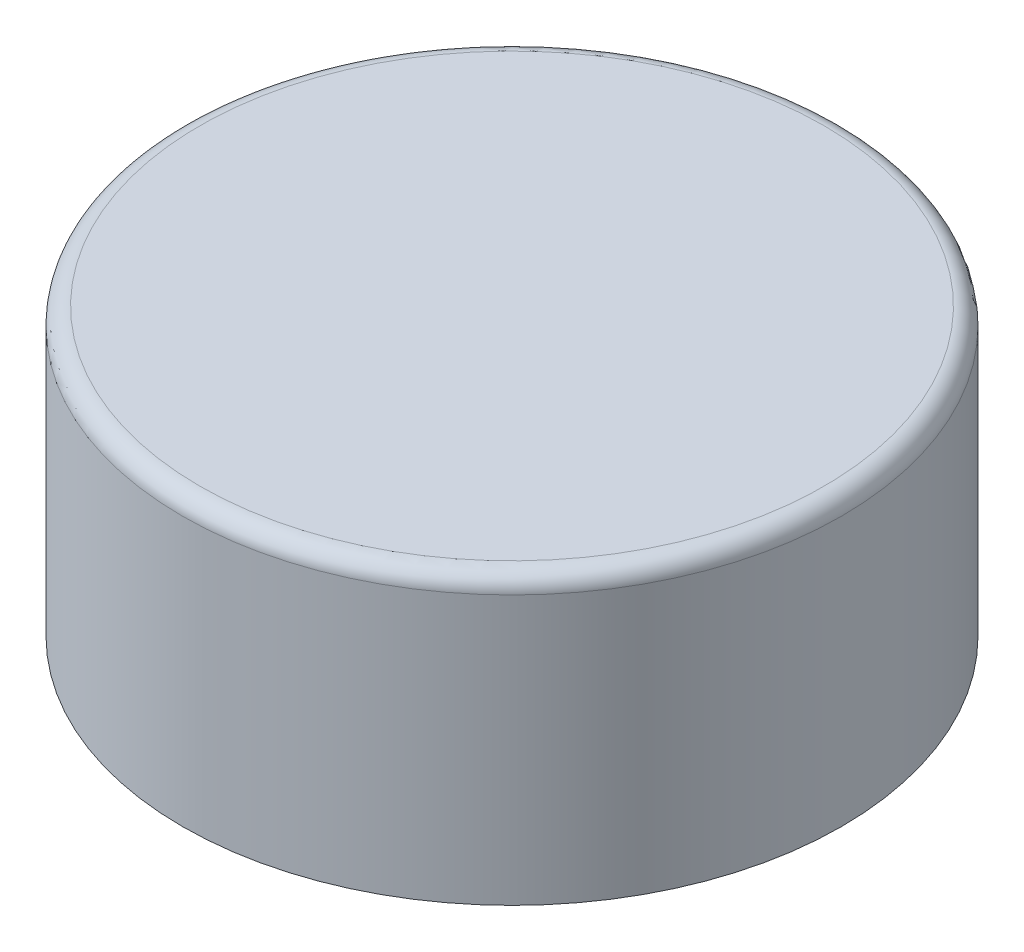
from build123d import *

# Parameters (mm, degrees)
SKETCH1_R           = 19
SKETCH1_R_2         = 18.1
BOSS_EXTRUDE1_DEPTH = 15
SWEEP1_PITCH        = 3.75
SKETCH5_R           = 19
BOSS_EXTRUDE2_DEPTH = 1.5
FILLET1_R           = 1


with BuildPart() as part:
    # Sketch1 → Boss-Extrude1 (new body)
    with BuildSketch(Plane(origin=(0, 0, 0), x_dir=(1, 0, 0), z_dir=(0, 1, 0))):
        with Locations(Location((0, 0, 0), (0, 0, 270))):
            Circle(SKETCH1_R)
        with Locations(Location((0, 0, 0), (0, 0, 270))):
            Circle(SKETCH1_R_2, mode=Mode.SUBTRACT)
    extrude(amount=BOSS_EXTRUDE1_DEPTH)

    # Sweep1: the profile of Sketch2 screwed along a right-hand helix of 4 turns, 12 arcs to a turn; built about Z, then put on its axis
    sweep1_z = Axis((0, 0, 0), (0, 0, 1))
    sweep1_corners = [(18.1, 0, 0), (18.1, 0, 1.8), (17.15, 0, 1.3), (17.15, 0, -1.3), (18.1, 0, -1.8)]
    with BuildLine(mode=Mode.PRIVATE) as sweep1_profile:
        Line(sweep1_corners[0], sweep1_corners[1])
        Line(sweep1_corners[1], sweep1_corners[2])
        Line(sweep1_corners[2], sweep1_corners[3])
        Line(sweep1_corners[3], sweep1_corners[4])
        Line(sweep1_corners[4], sweep1_corners[0])
    sweep1_cap = Face(sweep1_profile.wire())
    sweep1_turn_angles = [0, 15, 30, 45, 60, 75, 90, 105, 120, 135, 150, 165, 180, 195, 210, 225, 240, 255, 270, 285, 300, 315, 330, 345, 360]
    sweep1_turn_weights = [1, 0.9659258262890683, 1, 0.9659258262890683, 1, 0.9659258262890683, 1, 0.9659258262890683, 1, 0.9659258262890683, 1, 0.9659258262890683, 1, 0.9659258262890683, 1, 0.9659258262890683, 1, 0.9659258262890683, 1, 0.9659258262890683, 1, 0.9659258262890683, 1, 0.9659258262890683, 1]
    sweep1_turn_rails = [Edge.make_bspline([Vector(p[0], p[1], 0).rotate(sweep1_z, sweep1_turn_angles[k]) / sweep1_turn_weights[k] + Vector(0, 0, p[2] + SWEEP1_PITCH * sweep1_turn_angles[k] / 360) for k in range(25)], [0, 0, 0, 1, 1, 2, 2, 3, 3, 4, 4, 5, 5, 6, 6, 7, 7, 8, 8, 9, 9, 10, 10, 11, 11, 12, 12, 12], 2, sweep1_turn_weights) for p in sweep1_corners]
    sweep1_turn_sides = [Face.make_surface_from_curves(sweep1_turn_rails[p[0]], sweep1_turn_rails[p[1]]) for p in [(0, 1), (1, 2), (2, 3), (3, 4), (4, 0)]]
    sweep1 = Plane(origin=(0, 0, 0), x_dir=(-1, 0, 0), z_dir=(0, 1, 0)) * Solid(Shell([*[p.moved(Location((0, 0, SWEEP1_PITCH * i))) for i in range(4) for p in sweep1_turn_sides], sweep1_cap, sweep1_cap.rotate(sweep1_z, 1440).moved(Location((0, 0, SWEEP1_PITCH * 1440 / 360)))]))
    add(sweep1)

    # SurfaceCut1
    split(bisect_by=Plane(origin=(0, 15, 0), x_dir=(1, 0, 0), z_dir=(0, 1, 0)), keep=Keep.BOTTOM)

    # SurfaceCut2
    split(bisect_by=Plane(origin=(0, 0, 0), x_dir=(-1, 0, 0), z_dir=(0, -1, 0)), keep=Keep.BOTTOM)

    # Sketch5 → Boss-Extrude2 (add)
    with BuildSketch(Plane(origin=(0, 15, 0), x_dir=(1, 0, 0), z_dir=(0, 1, 0))):
        with Locations(Location((0, 0, 0), (0, 0, 270))):
            Circle(SKETCH5_R)
    extrude(amount=BOSS_EXTRUDE2_DEPTH)

    # Fillet1
    fillet1_edges = [part.edges().sort_by_distance(p)[0] for p in [
        (0, 16.5, -19),
    ]]
    fillet(fillet1_edges, radius=FILLET1_R)


solid = part.part
